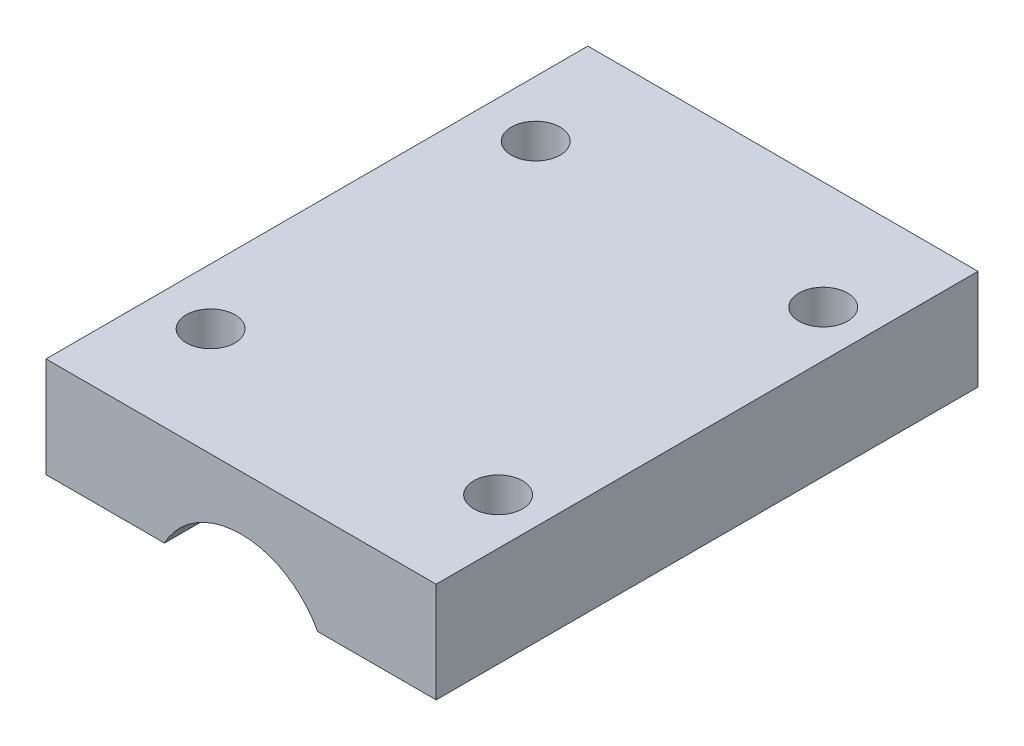
from build123d import *

# Parameters (mm, degrees)
IZIM1_W                     = 36
IZIM1_H                     = 36
IZIM1_R                     = 8
Y_KSEKLIK_EKSTR_ZYON1_DEPTH = 50
IZIM2_W                     = 36
IZIM2_H                     = 5
KES_EKSTR_ZYON1_DEPTH       = 50
IZIM3_W                     = 36
IZIM3_H                     = 3
KES_EKSTR_ZYON2_DEPTH       = 50
KES_EKSTR_ZYON3_DEPTH       = 50
M4_BO_LUKLU_DELIK1_D        = 4.5
KES_EKSTR_ZYON6_START       = -50
KES_EKSTR_ZYON6_DEPTH       = 50


# Read off the part's stored shape, not the designer's step: Kes-Ekstrüzyon6
with BuildPart() as part:
    # Çizim1 → Yükseklik-Ekstrüzyon1 (new body)
    with BuildSketch(Plane.XY):
        Rectangle(IZIM1_W, IZIM1_H)
        Circle(IZIM1_R, mode=Mode.SUBTRACT)
    extrude(amount=Y_KSEKLIK_EKSTR_ZYON1_DEPTH)

    # Çizim2 → Kes-Ekstrüzyon1 (cut)
    with BuildSketch(Plane.XY.offset(50)):
        with Locations((0, 15.5)):
            Rectangle(IZIM2_W, IZIM2_H)
    extrude(amount=-KES_EKSTR_ZYON1_DEPTH, mode=Mode.SUBTRACT)

    # Çizim3 → Kes-Ekstrüzyon2 (cut)
    with BuildSketch(Plane.XY.offset(50)):
        with Locations((0, -16.5)):
            Rectangle(IZIM3_W, IZIM3_H)
    extrude(amount=-KES_EKSTR_ZYON2_DEPTH, mode=Mode.SUBTRACT)

    # Çizim4 → Kes-Ekstrüzyon3 (cut)
    with BuildSketch(Plane.XY.offset(50)):
        Polygon((-6.350852961, -11), (-9.526279442, -5.5), (-18, -5.5), (-18, -15), (18, -15), (18, -5.5), (9.526279442, -5.5), (6.350852961, -11), align=None)
    extrude(amount=-KES_EKSTR_ZYON3_DEPTH, mode=Mode.SUBTRACT)

    # M4 Boşluklu Delik1 (through all)
    with Locations(Plane(origin=(0, -5.5, 0), x_dir=(-1, 0, 0), z_dir=(0, -1, 0))):
        with Locations((-13.718329125, -40), (-13.718329125, -10), (12.810498521, -10), (12.810498521, -40)):
            Hole(M4_BO_LUKLU_DELIK1_D / 2)

    # Kes-Ekstrüzyon6 outline → Kes-Ekstrüzyon6 (cut)
    with BuildSketch(Plane.XY.offset(50).offset(KES_EKSTR_ZYON6_START)):
        with BuildLine():
            Line((18, -5.5), (18, 3.75))
            Line((18, 3.75), (7.066647013, 3.75))
            ThreePointArc((7.066647013, 3.75), (0, -8), (-7.066647013, 3.75))
            Line((-7.066647013, 3.75), (-18, 3.75))
            Line((-18, 3.75), (-18, -5.5))
            Line((-18, -5.5), (-9.526279442, -5.5))
            Line((-9.526279442, -5.5), (-6.350852961, -11))
            Line((-6.350852961, -11), (6.350852961, -11))
            Line((6.350852961, -11), (9.526279442, -5.5))
            Line((9.526279442, -5.5), (18, -5.5))
        make_face()
    extrude(amount=KES_EKSTR_ZYON6_DEPTH, mode=Mode.SUBTRACT)


solid = part.part
